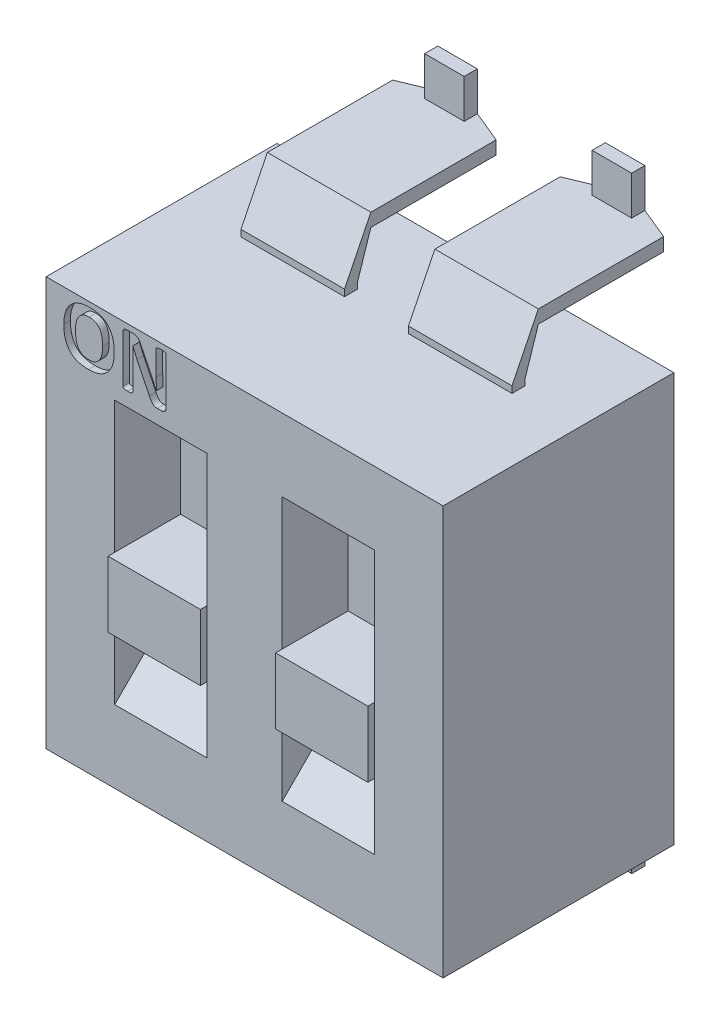
from build123d import *

# Parameters (mm, degrees)
SKETCH_1_W                         = 6.02
SKETCH_1_H                         = 6.2
EXTRUDE_1_DEPTH                    = 3.5
SKETCH_2_W                         = 1.57
SKETCH_2_H                         = 0.2
EXTRUDE_2_DEPTH                    = 0.1
SKETCH_3_W                         = 0.6
SKETCH_3_H                         = 0.79
EXTRUDE_3_DEPTH                    = 0.2
SKETCH_4_W                         = 1.57
SKETCH_4_H                         = 0.2
EXTRUDE_4_DEPTH                    = 1.9
CHAMFER_1_SIZE                     = 0.2
CHAMFER_1_SIZE_2                   = 0.485
LOFT_START                         = -2.055
LOFT_1_DEPTH                       = 1.57
SKETCH_5_W                         = 1.4
SKETCH_5_H                         = 2
CUT_EXTRUDE_1_DEPTH                = 1
CHAMFER_2_SIZE                     = 1
SKETCH_6_W                         = 1.4
SKETCH_6_H                         = 1
EXTRUDE_5_DEPTH                    = 1.1
PATTERN_LINEAR_3_COUNT             = 2
PATTERN_LINEAR_3_PITCH             = 2.54
CHAMFER_2_OF_PATTERN_LINEAR_3_SIZE = 1
PATTERN_LINEAR_1_COUNT             = 2
PATTERN_LINEAR_1_PITCH             = 2.54
CUT_EXTRUDE_2_DEPTH                = 0.1


# Read off the part's stored shape, not the designer's step: По сечениям1
# Some blends are built 0.0001 mm under size
with BuildPart() as part:
    # Эскиз1 → Бобышка-Вытянуть1 (new body)
    with BuildSketch(Plane.XY.offset(1)):
        Rectangle(SKETCH_1_W, SKETCH_1_H)
    extrude(amount=EXTRUDE_1_DEPTH)

    # Эскиз5 → Вырез-Вытянуть1 (cut)
    with BuildSketch(Plane.XY.offset(4.5)):
        with Locations((-1.27, 0)):
            Rectangle(SKETCH_5_W, SKETCH_5_H)
    cut_extrude_1 = extrude(amount=-CUT_EXTRUDE_1_DEPTH, mode=Mode.SUBTRACT)

    # Фаска2
    chamfer_2_edges = [part.edges().sort_by_distance(p)[0] for p in [
        (-1.27, 1, 4.5),
        (-1.27, -1, 4.5),
    ]]
    chamfer(chamfer_2_edges, length=CHAMFER_2_SIZE - 0.0001)  # a hair under: the kernel refuses the full size

    # Линейный массив3: Вырез-Вытянуть1 ×2
    with Locations(*[(i * PATTERN_LINEAR_3_PITCH, 0, 0) for i in range(1, PATTERN_LINEAR_3_COUNT)]):
        add(cut_extrude_1, mode=Mode.SUBTRACT)

    # Фаска2 of Линейный массив3
    chamfer_2_of_pattern_linear_3_edges = [part.edges().sort_by_distance(p)[0] for p in [
        (1.27, 1, 4.5),
        (1.27, -1, 4.5),
    ]]
    chamfer(chamfer_2_of_pattern_linear_3_edges, length=CHAMFER_2_OF_PATTERN_LINEAR_3_SIZE - 0.0001)  # a hair under: the kernel refuses the full size

    # Эскиз7 → Вырез-Вытянуть2 (cut)
    # profile 1 of 2: a face of its own
    with BuildSketch(Plane.XY.offset(4.5)):
        with BuildLine():
            add(Edge.make_bspline(
                [(-1.976866689, 2.624292355), (-1.977097801, 2.608224408), (-1.977548772, 2.576870874), (-1.982537842, 2.531238744), (-1.990062185, 2.488089017), (-2.00111937, 2.447697444), (-2.014996784, 2.409942088), (-2.032183188, 2.375221702), (-2.052265813, 2.343327726), (-2.075527165, 2.314517229), (-2.101808582, 2.288794776), (-2.131009757, 2.26620407), (-2.163295163, 2.247048944), (-2.198326191, 2.231007372), (-2.236283773, 2.218437818), (-2.277159904, 2.209778238), (-2.320838787, 2.204353693), (-2.35093103, 2.203681674), (-2.366388748, 2.203336472)],
                knots=[0, 0, 0, 0, 1.181067455, 2.304627813, 3.371397041, 4.398875488, 5.379772852, 6.324840374, 7.24235265, 8.145895775, 9.041233988, 9.940678369, 10.854054564, 11.795635534, 12.76881339, 13.787809768, 14.863646999, 16, 16, 16, 16], degree=3))
            add(Edge.make_bspline(
                [(-2.366388748, 2.203336472), (-2.381598154, 2.203581062), (-2.411110644, 2.204055665), (-2.453880268, 2.208788088), (-2.493726274, 2.216123093), (-2.530569916, 2.226799589), (-2.56445885, 2.240566924), (-2.595409484, 2.257619913), (-2.623613742, 2.277653766), (-2.648633127, 2.301287755), (-2.670673626, 2.328165272), (-2.689635095, 2.358439627), (-2.705908855, 2.391940346), (-2.719061129, 2.428948523), (-2.729343046, 2.469312984), (-2.736298139, 2.513190761), (-2.74081916, 2.56047209), (-2.741315856, 2.593214969), (-2.741572571, 2.610137943)],
                knots=[0, 0, 0, 0, 1.14605125, 2.223809784, 3.239278066, 4.196657126, 5.110123641, 5.990760065, 6.854667985, 7.710749604, 8.577135683, 9.46770869, 10.397275983, 11.379066547, 12.423123567, 13.532494508, 14.724683554, 16, 16, 16, 16], degree=3))
            add(Edge.make_bspline(
                [(-2.741572571, 2.610137943), (-2.741232802, 2.625834129), (-2.740569016, 2.656498823), (-2.736043562, 2.701274486), (-2.728063871, 2.743536163), (-2.717337732, 2.783389013), (-2.703377675, 2.82066854), (-2.686316679, 2.855144342), (-2.666115287, 2.886725641), (-2.642859687, 2.915332498), (-2.616639807, 2.941052085), (-2.58745282, 2.963567874), (-2.555302521, 2.982847624), (-2.5202097, 2.998821852), (-2.482166051, 3.011580412), (-2.441174953, 3.020453644), (-2.397292985, 3.025853615), (-2.367078909, 3.026521493), (-2.351499042, 3.026865884)],
                knots=[0, 0, 0, 0, 1.160914008, 2.268007866, 3.323978369, 4.338756358, 5.316875162, 6.263384146, 7.178594241, 8.083875972, 8.984426194, 9.889106488, 10.803912537, 11.750974708, 12.735550296, 13.765875032, 14.847975007, 16, 16, 16, 16], degree=3))
            add(Edge.make_bspline(
                [(-2.351499042, 3.026865884), (-2.336596313, 3.026618397), (-2.30763459, 3.026137436), (-2.265592662, 3.021423304), (-2.226283626, 3.013983422), (-2.189654488, 3.003581674), (-2.15580969, 2.989931446), (-2.124684371, 2.973275681), (-2.096628887, 2.952979621), (-2.071525018, 2.929441428), (-2.049031624, 2.902858905), (-2.029970605, 2.872722721), (-2.013437734, 2.839575376), (-2.000130264, 2.802976646), (-1.989689838, 2.763091843), (-1.982275107, 2.719859961), (-1.977583518, 2.673231733), (-1.977110984, 2.64097089), (-1.976866689, 2.624292355)],
                knots=[0, 0, 0, 0, 1.132472299, 2.200828589, 3.21116476, 4.170875335, 5.090315408, 5.980258557, 6.84769598, 7.714420291, 8.590505985, 9.487188694, 10.418317356, 11.401257481, 12.441795894, 13.548338263, 14.732515217, 16, 16, 16, 16], degree=3))
        make_face()
        with BuildLine():
            add(Edge.make_bspline(
                [(-2.153337277, 2.615468825), (-2.153424306, 2.625827106), (-2.15359439, 2.646070794), (-2.155469716, 2.675699795), (-2.158540535, 2.703867305), (-2.162949148, 2.73050154), (-2.168487363, 2.75565076), (-2.175950121, 2.778937081), (-2.1852716, 2.800319107), (-2.196018978, 2.819921425), (-2.208800482, 2.837574733), (-2.223570471, 2.853183042), (-2.240517809, 2.866425037), (-2.259220545, 2.877871373), (-2.280299707, 2.886677435), (-2.303676743, 2.893176781), (-2.329577411, 2.896719055), (-2.347628531, 2.897202674), (-2.357013748, 2.897454119)],
                knots=[0, 0, 0, 0, 1.248306964, 2.439626501, 3.576526119, 4.66195957, 5.692118455, 6.677712867, 7.603820791, 8.499754584, 9.366886977, 10.223578091, 11.080555655, 11.951954716, 12.85865995, 13.824437323, 14.868871972, 16, 16, 16, 16], degree=3))
            add(Edge.make_bspline(
                [(-2.357013748, 2.897454119), (-2.366528222, 2.897182105), (-2.384800536, 2.896659709), (-2.411062364, 2.892395515), (-2.434910337, 2.885325264), (-2.456324313, 2.875255215), (-2.475321517, 2.86278921), (-2.492462424, 2.848521244), (-2.507588551, 2.832224652), (-2.520817532, 2.814103681), (-2.532394195, 2.794334978), (-2.541519791, 2.77264294), (-2.549671936, 2.749652562), (-2.555266642, 2.724993087), (-2.559676863, 2.69933233), (-2.562693973, 2.672813155), (-2.564898177, 2.645591707), (-2.565033504, 2.627176912), (-2.565101983, 2.617858531)],
                knots=[0, 0, 0, 0, 1.153225958, 2.214741912, 3.216094119, 4.16009031, 5.073077605, 5.964494141, 6.858230186, 7.761795903, 8.68066018, 9.629003448, 10.611206296, 11.634860154, 12.690273443, 13.767663655, 14.870377893, 16, 16, 16, 16], degree=3))
            add(Edge.make_bspline(
                [(-2.565101983, 2.617858531), (-2.565012291, 2.607133201), (-2.564837379, 2.586217184), (-2.56301432, 2.555723262), (-2.559803594, 2.526914837), (-2.555823063, 2.499711487), (-2.549893049, 2.474354429), (-2.542625004, 2.450722224), (-2.533397285, 2.429105697), (-2.522838506, 2.409225507), (-2.510192519, 2.391476603), (-2.495476315, 2.375981423), (-2.47862493, 2.362807548), (-2.459972515, 2.351581802), (-2.4387445, 2.343077471), (-2.415181827, 2.337181664), (-2.389117695, 2.333424745), (-2.370936932, 2.332980597), (-2.361425512, 2.332748237)],
                knots=[0, 0, 0, 0, 1.279653928, 2.495518946, 3.642823718, 4.737874749, 5.773595616, 6.747088542, 7.68406817, 8.573908718, 9.428072391, 10.276175527, 11.114292987, 11.973199623, 12.865200127, 13.831639063, 14.865603682, 16, 16, 16, 16], degree=3))
            add(Edge.make_bspline(
                [(-2.361425512, 2.332748237), (-2.35191062, 2.333017803), (-2.333637505, 2.333535499), (-2.307456737, 2.337819837), (-2.283684841, 2.344735775), (-2.262244889, 2.354538836), (-2.243304863, 2.367124936), (-2.225917526, 2.381246489), (-2.210874103, 2.397823511), (-2.197538017, 2.416118704), (-2.186160651, 2.436262496), (-2.176584164, 2.458069128), (-2.168882846, 2.48147197), (-2.163123035, 2.506360422), (-2.158758683, 2.532405076), (-2.155745144, 2.559411749), (-2.153541495, 2.587185077), (-2.153405885, 2.605966768), (-2.153337277, 2.615468825)],
                knots=[0, 0, 0, 0, 1.144095152, 2.197206425, 3.181453363, 4.114866049, 5.020624657, 5.910648687, 6.802715632, 7.705078328, 8.629453105, 9.579998293, 10.566037856, 11.588758084, 12.650348858, 13.741173613, 14.857211693, 16, 16, 16, 16], degree=3))
        make_face(mode=Mode.SUBTRACT)
    # profile 2 of 2: a face of its own
    with BuildSketch(Plane.XY.offset(4.5)):
        with BuildLine():
            add(Edge.make_bspline(
                [(-1.188631395, 2.27300559), (-1.18884969, 2.268498585), (-1.189271318, 2.259793506), (-1.193298558, 2.247728656), (-1.199218425, 2.237363655), (-1.207131653, 2.228936085), (-1.216693945, 2.222337904), (-1.227735176, 2.218060017), (-1.239515322, 2.215739632), (-1.247506815, 2.215313871), (-1.251499042, 2.215101178)],
                knots=[0, 0, 0, 0, 1.120032347, 2.163292293, 3.135130692, 4.07524891, 5.019946156, 6.00690811, 7.004331812, 8, 8, 8, 8], degree=3))
            Line((-1.251499042, 2.215101178), (-1.322822571, 2.215101178))
            add(Edge.make_bspline(
                [(-1.322822571, 2.215101178), (-1.329757089, 2.215292875), (-1.34267711, 2.215650035), (-1.361073332, 2.218794159), (-1.377335059, 2.225474394), (-1.392063153, 2.235807611), (-1.405654403, 2.250079999), (-1.41855991, 2.26863811), (-1.431587259, 2.291890167), (-1.44007185, 2.309171954), (-1.444697571, 2.318593825)],
                knots=[0, 0, 0, 0, 0.966254035, 1.800272596, 2.585200708, 3.395271146, 4.288963202, 5.317323791, 6.537429596, 8, 8, 8, 8], degree=3))
            Line((-1.444697571, 2.318593825), (-1.631278453, 2.700211472))
            add(Edge.make_bspline(
                [(-1.631278453, 2.700211472), (-1.636774093, 2.711956728), (-1.648141784, 2.736251704), (-1.664625662, 2.773624179), (-1.680162929, 2.811974272), (-1.689790939, 2.837751059), (-1.694513748, 2.850395296)],
                knots=[0, 0, 0, 0, 0.954558477, 1.974497353, 3.006434174, 4, 4, 4, 4], degree=3))
            Line((-1.694513748, 2.850395296), (-1.695800512, 2.850395296))
            add(Edge.make_bspline(
                [(-1.695800512, 2.850395296), (-1.695453712, 2.835322431), (-1.694761582, 2.805240573), (-1.694446947, 2.759954491), (-1.694531165, 2.714059545), (-1.694519614, 2.68317717), (-1.694513748, 2.667490884)],
                knots=[0, 0, 0, 0, 0.989090355, 1.973989423, 2.970915262, 4, 4, 4, 4], degree=3))
            Line((-1.694513748, 2.667490884), (-1.694513748, 2.242123237))
            add(Edge.make_bspline(
                [(-1.694513748, 2.242123237), (-1.694699322, 2.240134585), (-1.695077074, 2.236086503), (-1.697984659, 2.230359684), (-1.703228726, 2.2255096), (-1.710915539, 2.221699411), (-1.721412197, 2.218951878), (-1.734915961, 2.21650055), (-1.752159626, 2.215463635), (-1.764857219, 2.215230533), (-1.771903453, 2.215101178)],
                knots=[0, 0, 0, 0, 0.533239368, 1.085457576, 1.679302583, 2.423102222, 3.366158425, 4.586936804, 6.105999776, 8, 8, 8, 8], degree=3))
            add(Edge.make_bspline(
                [(-1.771903453, 2.215101178), (-1.778766307, 2.215227258), (-1.791280773, 2.215457165), (-1.808264851, 2.216551037), (-1.821714304, 2.218778265), (-1.832104454, 2.221407452), (-1.839433875, 2.225405258), (-1.84459098, 2.2299363), (-1.847061938, 2.235664332), (-1.847323291, 2.239593039), (-1.847454924, 2.241571766)],
                knots=[0, 0, 0, 0, 1.880338663, 3.428811631, 4.65383513, 5.615149483, 6.343797838, 6.92541045, 7.458773589, 8, 8, 8, 8], degree=3))
            Line((-1.847454924, 2.241571766), (-1.847454924, 2.957196766))
            add(Edge.make_bspline(
                [(-1.847454924, 2.957196766), (-1.847271502, 2.961754809), (-1.84692383, 2.970394494), (-1.843566214, 2.982458662), (-1.837989596, 2.992764459), (-1.829982006, 3.000891105), (-1.820632978, 3.007388932), (-1.809923353, 3.011710101), (-1.798406526, 3.014630133), (-1.790366159, 3.014941471), (-1.786241689, 3.015101178)],
                knots=[0, 0, 0, 0, 1.146599659, 2.173358234, 3.127386818, 4.066803063, 5.022080866, 5.977233821, 6.962380843, 8, 8, 8, 8], degree=3))
            Line((-1.786241689, 3.015101178), (-1.695432865, 3.015101178))
            add(Edge.make_bspline(
                [(-1.695432865, 3.015101178), (-1.687879137, 3.015006844), (-1.674040695, 3.014834024), (-1.654891792, 3.011600748), (-1.638297071, 3.006539747), (-1.623815066, 2.998108713), (-1.61059335, 2.986729888), (-1.598624443, 2.971772587), (-1.58720741, 2.953300815), (-1.580472552, 2.939436134), (-1.576866689, 2.932012943)],
                knots=[0, 0, 0, 0, 1.157819279, 2.121126641, 2.971782284, 3.805898374, 4.67303314, 5.635237899, 6.733899397, 8, 8, 8, 8], degree=3))
            Line((-1.576866689, 2.932012943), (-1.431462277, 2.641020296))
            add(Edge.make_bspline(
                [(-1.431462277, 2.641020296), (-1.427222118, 2.632263888), (-1.418837143, 2.61494797), (-1.406545211, 2.589019944), (-1.394051963, 2.563577915), (-1.382449389, 2.538042304), (-1.371008616, 2.512878217), (-1.35998608, 2.487969856), (-1.349080925, 2.463302104), (-1.341988788, 2.446846923), (-1.338447571, 2.43863059)],
                knots=[0, 0, 0, 0, 1.048159491, 2.072750013, 3.091389825, 4.101587992, 5.094292605, 6.069547355, 7.0360943, 8, 8, 8, 8], degree=3))
            add(Edge.make_bspline(
                [(-1.338447571, 2.43863059), (-1.338494604, 2.453212441), (-1.339716494, 2.482982415), (-1.340673579, 2.527966043), (-1.341508749, 2.572818698), (-1.341551652, 2.602478226), (-1.341572571, 2.616939413)],
                knots=[0, 0, 0, 0, 0.981864332, 2.004551901, 3.027073275, 4, 4, 4, 4], degree=3))
            Line((-1.341572571, 2.616939413), (-1.341572571, 2.988814413))
            add(Edge.make_bspline(
                [(-1.341572571, 2.988814413), (-1.341409226, 2.990753829), (-1.341078124, 2.994685059), (-1.337749015, 3.00015271), (-1.332236054, 3.004857789), (-1.324262919, 3.008864937), (-1.313560533, 3.011898881), (-1.299834246, 3.013702314), (-1.282652413, 3.015023634), (-1.269946409, 3.015073506), (-1.2628961, 3.015101178)],
                knots=[0, 0, 0, 0, 0.513514522, 1.040903369, 1.654763982, 2.430140109, 3.402872071, 4.610164628, 6.119047709, 8, 8, 8, 8], degree=3))
            add(Edge.make_bspline(
                [(-1.2628961, 3.015101178), (-1.256151823, 3.015072332), (-1.243873749, 3.015019816), (-1.227186096, 3.013677732), (-1.213866282, 3.011966581), (-1.203735854, 3.008931539), (-1.196550519, 3.004835541), (-1.191836409, 3.000014636), (-1.188930704, 2.994557676), (-1.188732148, 2.990625755), (-1.188631395, 2.98863059)],
                knots=[0, 0, 0, 0, 1.872486456, 3.408893843, 4.648537669, 5.595853804, 6.328496016, 6.918324485, 7.451128226, 8, 8, 8, 8], degree=3))
            Line((-1.188631395, 2.98863059), (-1.188631395, 2.27300559))
        make_face()
    extrude(amount=-CUT_EXTRUDE_2_DEPTH, mode=Mode.SUBTRACT)


with BuildPart() as body_2:
    # Эскиз2 → Бобышка-Вытянуть2 (new body)
    with BuildSketch(Plane.XZ.offset(3.1)):
        with Locations((-1.27, 2.4)):
            Rectangle(SKETCH_2_W, SKETCH_2_H)
    extrude(amount=EXTRUDE_2_DEPTH)



with BuildPart() as body_3:
    # Эскиз3 → Бобышка-Вытянуть3 (new body)
    with BuildSketch(Plane.XY):
        with Locations((-1.27, -4.205)):
            Rectangle(SKETCH_3_W, SKETCH_3_H)
    extrude(amount=EXTRUDE_3_DEPTH)

    # Эскиз4 → Бобышка-Вытянуть4 (add)
    with BuildSketch(Plane.XY.offset(0.2)):
        with Locations((-1.27, -3.91)):
            Rectangle(SKETCH_4_W, SKETCH_4_H)
    extrude(amount=EXTRUDE_4_DEPTH)

    # Фаска1
    # the kernel refuses this chamfer: 0.485, 0.2 mm, written as the material it adds along each edge
    with BuildSketch(Plane(origin=(-0.97, -3.81, 0.2), x_dir=(-0.08615522911587817, 0, -0.9962817254652372), z_dir=(0, -1, 0)), Plane(origin=(-1.57, -4.01, 0.2), x_dir=(0.08615522911587765, 0, -0.9962817254652374), z_dir=(0, 1, 0))) as chamfer_1_piece_1:
        Polygon((CHAMFER_1_SIZE * 0.996281725465, CHAMFER_1_SIZE * 0.0861552291159), (-CHAMFER_1_SIZE_2 * 0.0861552291159, CHAMFER_1_SIZE_2 * 0.996281725465), (0, 0), align=None)
    extrude(amount=0.2)


with BuildPart() as body_2_1:
    add(body_2.part)

    add(body_3.part)  # По сечениям1 merges body 3
    # По сечениям1 outline → По сечениям1 (add)
    with BuildSketch(Plane.YZ.offset(LOFT_START)):
        Polygon((-3.2, 2.3), (-3.2, 2.5), (-4.01, 2.1), (-3.81, 2.1), align=None)
    extrude(amount=LOFT_1_DEPTH)


with BuildPart() as body_3_2:
    # Эскиз6 → Бобышка-Вытянуть5 (new body)
    with BuildSketch(Plane.XY.offset(3.5)):
        with Locations((-1.27, -0.5)):
            Rectangle(SKETCH_6_W, SKETCH_6_H)
    extrude(amount=EXTRUDE_5_DEPTH)


with BuildPart() as body_4:
    # Зеркальное отражение1: mirrored copy
    add(body_2_1.part.mirror(Plane.ZX))


with BuildPart() as pattern_linear_1_1:
    # Линейный массив1: pattern copy
    add(body_4.part.moved(Location(Vector(1, 0, 0) * (1 * PATTERN_LINEAR_1_PITCH))))


with BuildPart() as pattern_linear_1_2:
    # Линейный массив1: pattern copy
    add(body_2_1.part.moved(Location(Vector(1, 0, 0) * (1 * PATTERN_LINEAR_1_PITCH))))


with BuildPart() as pattern_linear_1_3:
    # Линейный массив1: pattern copy
    add(body_3_2.part.moved(Location(Vector(1, 0, 0) * (1 * PATTERN_LINEAR_1_PITCH))))


solid = Compound([part.part, body_2_1.part, body_3_2.part, body_4.part, pattern_linear_1_1.part, pattern_linear_1_2.part, pattern_linear_1_3.part])
